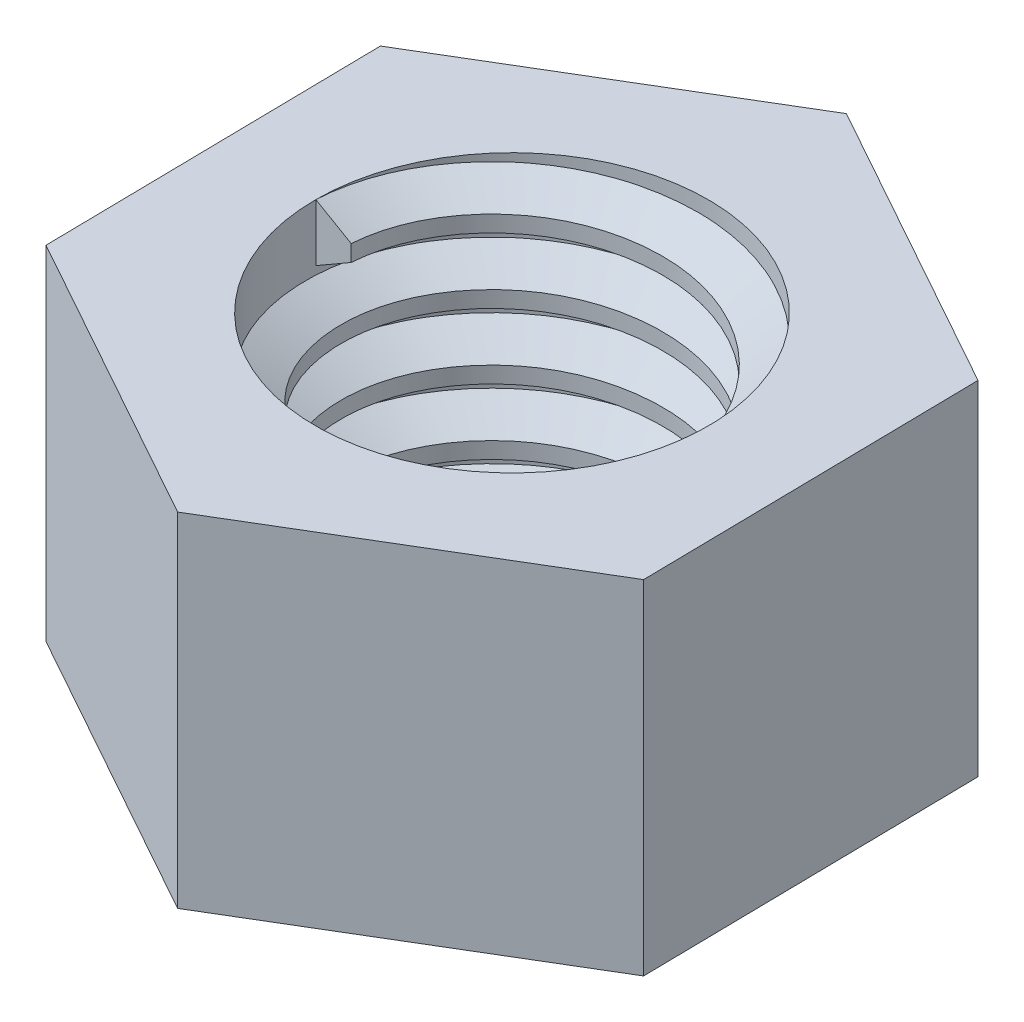
from build123d import *

# Parameters (mm, degrees)
SKETCH1_R           = 4.7625
BOSS_EXTRUDE1_DEPTH = 8.334375
THREAD1_PITCH       = 1.5875
SKETCH4_R           = 12.567359357
CUT_EXTRUDE1_DEPTH  = 16.271875


with BuildPart() as part:
    # Sketch1 → Boss-Extrude1 (new body)
    with BuildSketch(Plane(origin=(0, 0, 0), x_dir=(1, 0, 0), z_dir=(0, 1, 0))):
        Polygon((7.078093461, 4.236131692), (-0.129550929, 8.247874593), (-7.20764439, 4.011742901), (-7.078093461, -4.236131692), (0.129550929, -8.247874593), (7.20764439, -4.011742901), align=None)
        with Locations(Location((0, 0, 0), (0, 0, 270))):
            Circle(SKETCH1_R, mode=Mode.SUBTRACT)
    extrude(amount=BOSS_EXTRUDE1_DEPTH)

    # Thread1: the profile of Thread Profile1 profile screwed along a right-hand helix of 5.25 turns, 8 arcs to a turn; built about Z, then put on its axis
    thread1_z = Axis((0, 0, 0), (0, 0, 1))
    thread1_corners = [(4.7628, 0, -0.000173205), (4.7628, 0, 1.389235701), (3.903240423, 0, 0.892968748), (3.903240423, 0, 0.496093748)]
    with BuildLine(mode=Mode.PRIVATE) as thread1_profile:
        Line(thread1_corners[0], thread1_corners[1])
        Line(thread1_corners[1], thread1_corners[2])
        Line(thread1_corners[2], thread1_corners[3])
        Line(thread1_corners[3], thread1_corners[0])
    thread1_cap = Face(thread1_profile.wire())
    thread1_turn_angles = [0, 22.5, 45, 67.5, 90, 112.5, 135, 157.5, 180, 202.5, 225, 247.5, 270, 292.5, 315, 337.5, 360]
    thread1_turn_weights = [1, 0.9238795325112867, 1, 0.9238795325112867, 1, 0.9238795325112867, 1, 0.9238795325112867, 1, 0.9238795325112867, 1, 0.9238795325112867, 1, 0.9238795325112867, 1, 0.9238795325112867, 1]
    thread1_turn_rails = [Edge.make_bspline([Vector(p[0], p[1], 0).rotate(thread1_z, thread1_turn_angles[k]) / thread1_turn_weights[k] + Vector(0, 0, p[2] + THREAD1_PITCH * thread1_turn_angles[k] / 360) for k in range(17)], [0, 0, 0, 1, 1, 2, 2, 3, 3, 4, 4, 5, 5, 6, 6, 7, 7, 8, 8, 8], 2, thread1_turn_weights) for p in thread1_corners]
    thread1_turn_sides = [Face.make_surface_from_curves(thread1_turn_rails[p[0]], thread1_turn_rails[p[1]]) for p in [(0, 1), (1, 2), (2, 3), (3, 0)]]
    thread1_last_angles = [1800, 1822.5, 1845, 1867.5, 1890]
    thread1_last_weights = [1, 0.9238795325112867, 1, 0.9238795325112867, 1]
    thread1_last_rails = [Edge.make_bspline([Vector(p[0], p[1], 0).rotate(thread1_z, thread1_last_angles[k]) / thread1_last_weights[k] + Vector(0, 0, p[2] + THREAD1_PITCH * thread1_last_angles[k] / 360) for k in range(5)], [0, 0, 0, 1, 1, 2, 2, 2], 2, thread1_last_weights) for p in thread1_corners]
    thread1_last_sides = [Face.make_surface_from_curves(thread1_last_rails[p[0]], thread1_last_rails[p[1]]) for p in [(0, 1), (1, 2), (2, 3), (3, 0)]]
    thread1 = Plane(origin=(0, 8.334375, 0), x_dir=(-1, 0, 0), z_dir=(0, -1, 0)) * Solid(Shell([*[p.moved(Location((0, 0, THREAD1_PITCH * i))) for i in range(5) for p in thread1_turn_sides], *thread1_last_sides, thread1_cap, thread1_cap.rotate(thread1_z, 1890).moved(Location((0, 0, THREAD1_PITCH * 1890 / 360)))]))
    add(thread1)

    # Sketch4 → Cut-Extrude1 (cut)
    with BuildSketch(Plane.XZ):
        Circle(SKETCH4_R)
    extrude(amount=CUT_EXTRUDE1_DEPTH, mode=Mode.SUBTRACT)


solid = part.part
